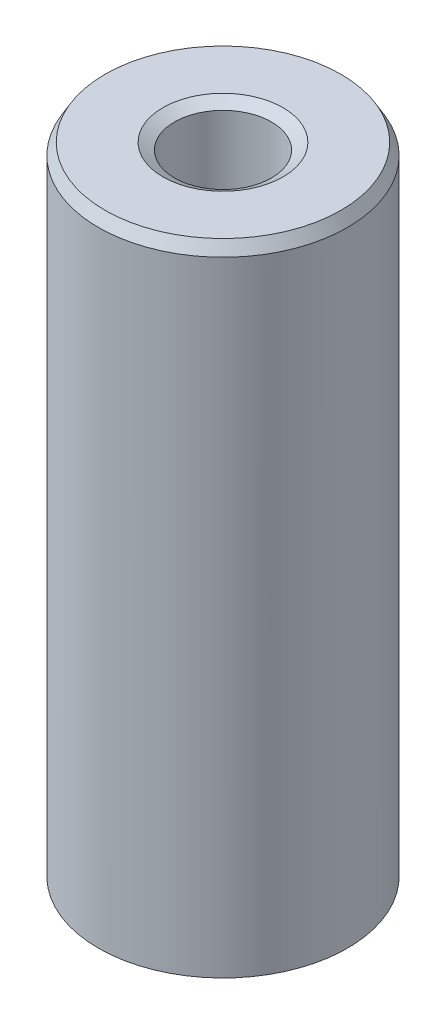
from build123d import *
from OCP.BRepFilletAPI import BRepFilletAPI_MakeChamfer

# Parameters (mm, degrees)
SKETCH1_R           = 35
BOSS_EXTRUDE1_DEPTH = 180.484742914
SKETCH2_R           = 13.636877671
CUT_EXTRUDE1_DEPTH  = 188.148984567
CHAMFER1_SIZE       = 3.235515873
CHAMFER1_SIZE2      = 1.86802596


with BuildPart() as part:
    # Sketch1 → Boss-Extrude1 (new body)
    with BuildSketch(Plane(origin=(0, 0, 0), x_dir=(1, 0, 0), z_dir=(0, 1, 0))):
        Circle(SKETCH1_R)
    extrude(amount=BOSS_EXTRUDE1_DEPTH)

    # Sketch2 → Cut-Extrude1 (cut, through all)
    with BuildSketch(Plane(origin=(0, 0, 0), x_dir=(1, 0, 0), z_dir=(0, 1, 0))):
        Circle(SKETCH2_R)
    extrude(amount=CUT_EXTRUDE1_DEPTH, mode=Mode.SUBTRACT)

    # Chamfer1: one chamfer whose edges measure the first distance from different faces: ONE call of the kernel's chamfer builder (chamfer() names one face for all edges)
    chamfer1_edges_1 = [part.edges().sort_by_distance(p)[0] for p in [
        (-13.636877671, 180.484742914, 0),
    ]]
    chamfer1_side_1 = [part.faces().sort_by_distance(p)[0] for p in [
        (-34.010050506, 180.484742914, 0),
    ]]
    chamfer1_edges_2 = [part.edges().sort_by_distance(p)[0] for p in [
        (-13.636877671, 0, 0),
    ]]
    chamfer1_side_2 = [part.faces().sort_by_distance(p)[0] for p in [
        (-13.636877671, 90.242371457, 0),
    ]]
    chamfer1_edges_3 = [part.edges().sort_by_distance(p)[0] for p in [
        (-35, 0, 0),
    ]]
    chamfer1_side_3 = [part.faces().sort_by_distance(p)[0] for p in [
        (-34.010050506, 0, 0),
    ]]
    chamfer1_edges_4 = [part.edges().sort_by_distance(p)[0] for p in [
        (-35, 180.484742914, 0),
    ]]
    chamfer1_side_4 = [part.faces().sort_by_distance(p)[0] for p in [
        (-35, 90.242371457, 0),
    ]]
    chamfer1 = BRepFilletAPI_MakeChamfer(part.part.solid().wrapped)
    for e in chamfer1_edges_1:
        chamfer1.Add(CHAMFER1_SIZE, CHAMFER1_SIZE2, e.wrapped, chamfer1_side_1[0].wrapped)  # the first distance lies on this face
    for e in chamfer1_edges_2:
        chamfer1.Add(CHAMFER1_SIZE, CHAMFER1_SIZE2, e.wrapped, chamfer1_side_2[0].wrapped)  # the first distance lies on this face
    for e in chamfer1_edges_3:
        chamfer1.Add(CHAMFER1_SIZE, CHAMFER1_SIZE2, e.wrapped, chamfer1_side_3[0].wrapped)  # the first distance lies on this face
    for e in chamfer1_edges_4:
        chamfer1.Add(CHAMFER1_SIZE, CHAMFER1_SIZE2, e.wrapped, chamfer1_side_4[0].wrapped)  # the first distance lies on this face
    add(Compound.cast(chamfer1.Shape()), mode=Mode.REPLACE)


solid = part.part
